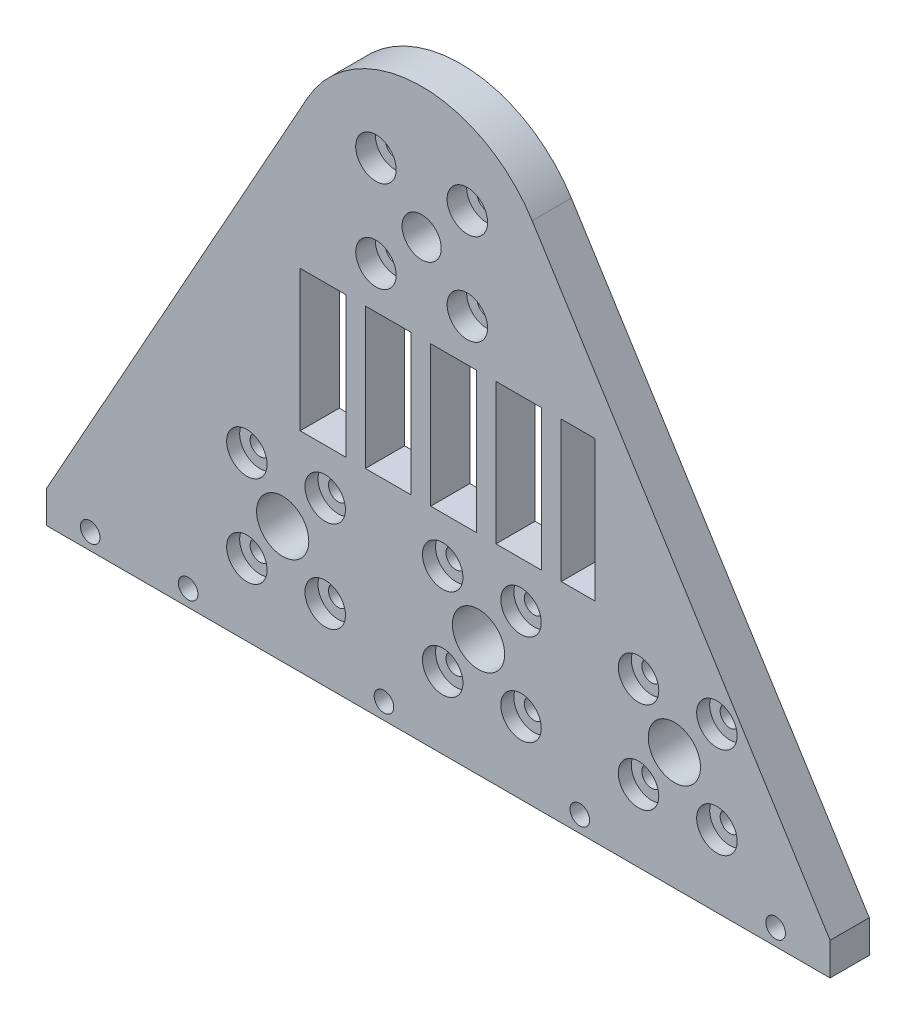
from build123d import *

# Parameters (mm, degrees)
SKETCH_1_R           = 3
EXTRUDE_1_DEPTH      = 6
SKETCH_2_R           = 3.1
CUT_EXTRUDE_6_DEPTH  = 3
SKETCH_4_R           = 1.5
CUT_EXTRUDE_7_DEPTH  = 118.004713387
CUT_EXTRUDE_8_REACH  = 119.12
SKETCH_5_W           = 7
SKETCH_5_H           = 21.556656584
SKETCH_5_W_2         = 5.195776916
SKETCH_5_R           = 4
SKETCH_6_R           = 3.1
CUT_EXTRUDE_9_DEPTH  = 2
SKETCH_7_R           = 1.5
CUT_EXTRUDE_10_DEPTH = 118.034622889
SKETCH_8_R           = 1.5
CUT_EXTRUDE_11_DEPTH = 118.120036521


with BuildPart() as part:
    # 草图1 → 凸台-拉伸1 (new body)
    with BuildSketch(Plane.XY):
        with BuildLine():
            Line((53.211823486, 15.105307707), (98.846336292, -57.534028788))
            Line((98.846336292, -57.534028788), (98.846336292, -62.534028788))
            Line((98.846336292, -62.534028788), (-21.153663708, -62.534028788))
            Line((-21.153663708, -62.534028788), (-21.153663708, -57.534028788))
            Line((-21.153663708, -57.534028788), (18.804405563, 14.198660069))
            ThreePointArc((18.804405563, 14.198660069), (35.749695352, 24.459031414), (53.211823486, 15.105307707))
        make_face()
        with Locations((36.276519563, 4.465971212)):
            Circle(SKETCH_1_R, mode=Mode.SUBTRACT)
    extrude(amount=EXTRUDE_1_DEPTH)

    # 草图2 → 切除-拉伸6 (cut)
    with BuildSketch(Plane.XY.offset(6)):
        with Locations((29.276519563, 11.465971212)):
            Circle(SKETCH_2_R)
        with Locations((43.276519563, 11.465971212)):
            Circle(SKETCH_2_R)
        with Locations((43.276519563, -2.534028788)):
            Circle(SKETCH_2_R)
        with Locations((29.276519563, -2.534028788)):
            Circle(SKETCH_2_R)
    extrude(amount=-CUT_EXTRUDE_6_DEPTH, mode=Mode.SUBTRACT)

    # 草图4 → 切除-拉伸7 (cut, through all)
    with BuildSketch(Plane.XY.offset(3)):
        with Locations((43.276519563, 11.465971212)):
            Circle(SKETCH_4_R)
        with Locations((43.276519563, -2.534028788)):
            Circle(SKETCH_4_R)
        with Locations((29.276519563, -2.534028788)):
            Circle(SKETCH_4_R)
        with Locations((29.276519563, 11.465971212)):
            Circle(SKETCH_4_R)
    extrude(amount=-CUT_EXTRUDE_7_DEPTH, mode=Mode.SUBTRACT)

    # 草图5 → 切除-拉伸8 (cut, up to next)
    with BuildSketch(Plane.XY.offset(6), mode=Mode.PRIVATE) as cut_extrude_8_sk1:
        with Locations((21.160819148, -19.755700496)):
            Rectangle(SKETCH_5_W, SKETCH_5_H)
    cut_extrude_8_tool1 = extrude(cut_extrude_8_sk1.sketch, amount=-CUT_EXTRUDE_8_REACH, mode=Mode.PRIVATE) & part.part
    # 草图5 → 切除-拉伸8 (cut, up to next)
    with BuildSketch(Plane.XY.offset(6), mode=Mode.PRIVATE) as cut_extrude_8_sk2:
        with Locations((31.160819148, -19.755700496)):
            Rectangle(SKETCH_5_W, SKETCH_5_H)
    cut_extrude_8_tool2 = extrude(cut_extrude_8_sk2.sketch, amount=-CUT_EXTRUDE_8_REACH, mode=Mode.PRIVATE) & part.part
    # 草图5 → 切除-拉伸8 (cut, up to next)
    with BuildSketch(Plane.XY.offset(6), mode=Mode.PRIVATE) as cut_extrude_8_sk3:
        with Locations((41.160819148, -19.755700496)):
            Rectangle(SKETCH_5_W, SKETCH_5_H)
    cut_extrude_8_tool3 = extrude(cut_extrude_8_sk3.sketch, amount=-CUT_EXTRUDE_8_REACH, mode=Mode.PRIVATE) & part.part
    # 草图5 → 切除-拉伸8 (cut, up to next)
    with BuildSketch(Plane.XY.offset(6), mode=Mode.PRIVATE) as cut_extrude_8_sk4:
        with Locations((51.160819148, -19.755700496)):
            Rectangle(SKETCH_5_W, SKETCH_5_H)
    cut_extrude_8_tool4 = extrude(cut_extrude_8_sk4.sketch, amount=-CUT_EXTRUDE_8_REACH, mode=Mode.PRIVATE) & part.part
    # 草图5 → 切除-拉伸8 (cut, up to next)
    with BuildSketch(Plane.XY.offset(6), mode=Mode.PRIVATE) as cut_extrude_8_sk5:
        with Locations((60.258707606, -19.755700496)):
            Rectangle(SKETCH_5_W_2, SKETCH_5_H)
    cut_extrude_8_tool5 = extrude(cut_extrude_8_sk5.sketch, amount=-CUT_EXTRUDE_8_REACH, mode=Mode.PRIVATE) & part.part
    # 草图5 → 切除-拉伸8 (cut, up to next)
    with BuildSketch(Plane.XY.offset(6), mode=Mode.PRIVATE) as cut_extrude_8_sk6:
        with Locations((14.988200827, -44.534028788)):
            Circle(SKETCH_5_R)
    cut_extrude_8_tool6 = extrude(cut_extrude_8_sk6.sketch, amount=-CUT_EXTRUDE_8_REACH, mode=Mode.PRIVATE) & part.part
    # 草图5 → 切除-拉伸8 (cut, up to next)
    with BuildSketch(Plane.XY.offset(6), mode=Mode.PRIVATE) as cut_extrude_8_sk7:
        with Locations((44.988200827, -44.534028788)):
            Circle(SKETCH_5_R)
    cut_extrude_8_tool7 = extrude(cut_extrude_8_sk7.sketch, amount=-CUT_EXTRUDE_8_REACH, mode=Mode.PRIVATE) & part.part
    # 草图5 → 切除-拉伸8 (cut, up to next)
    with BuildSketch(Plane.XY.offset(6), mode=Mode.PRIVATE) as cut_extrude_8_sk8:
        with Locations((74.988200827, -44.534028788)):
            Circle(SKETCH_5_R)
    cut_extrude_8_tool8 = extrude(cut_extrude_8_sk8.sketch, amount=-CUT_EXTRUDE_8_REACH, mode=Mode.PRIVATE) & part.part
    add(cut_extrude_8_tool1.solids().sort_by_distance((21.160819, -19.7557, 6))[0], mode=Mode.SUBTRACT)
    add(cut_extrude_8_tool2.solids().sort_by_distance((31.160819, -19.7557, 6))[0], mode=Mode.SUBTRACT)
    add(cut_extrude_8_tool3.solids().sort_by_distance((41.160819, -19.7557, 6))[0], mode=Mode.SUBTRACT)
    add(cut_extrude_8_tool4.solids().sort_by_distance((51.160819, -19.7557, 6))[0], mode=Mode.SUBTRACT)
    add(cut_extrude_8_tool5.solids().sort_by_distance((60.258708, -19.7557, 6))[0], mode=Mode.SUBTRACT)
    add(cut_extrude_8_tool6.solids().sort_by_distance((14.988201, -44.534029, 6))[0], mode=Mode.SUBTRACT)
    add(cut_extrude_8_tool7.solids().sort_by_distance((44.988201, -44.534029, 6))[0], mode=Mode.SUBTRACT)
    add(cut_extrude_8_tool8.solids().sort_by_distance((74.988201, -44.534029, 6))[0], mode=Mode.SUBTRACT)

    # 草图6 → 切除-拉伸9 (cut)
    with BuildSketch(Plane.XY.offset(6)):
        with Locations((21.502321056, -37.534028788)):
            Circle(SKETCH_6_R)
        with Locations((9.502321056, -37.534028788)):
            Circle(SKETCH_6_R)
        with Locations((9.502321056, -51.534028788)):
            Circle(SKETCH_6_R)
        with Locations((21.502321056, -51.534028788)):
            Circle(SKETCH_6_R)
        with Locations((39.502321056, -37.534028788)):
            Circle(SKETCH_6_R)
        with Locations((51.502321056, -37.534028788)):
            Circle(SKETCH_6_R)
        with Locations((51.502321056, -51.534028788)):
            Circle(SKETCH_6_R)
        with Locations((39.502321056, -51.534028788)):
            Circle(SKETCH_6_R)
        with Locations((69.502321056, -37.534028788)):
            Circle(SKETCH_6_R)
        with Locations((81.502321056, -37.534028788)):
            Circle(SKETCH_6_R)
        with Locations((81.502321056, -51.534028788)):
            Circle(SKETCH_6_R)
        with Locations((69.502321056, -51.534028788)):
            Circle(SKETCH_6_R)
    extrude(amount=-CUT_EXTRUDE_9_DEPTH, mode=Mode.SUBTRACT)

    # 草图7 → 切除-拉伸10 (cut, through all)
    with BuildSketch(Plane.XY.offset(4)):
        with Locations((9.502321056, -37.534028788)):
            Circle(SKETCH_7_R)
        with Locations((21.502321056, -37.534028788)):
            Circle(SKETCH_7_R)
        with Locations((9.502321056, -51.534028788)):
            Circle(SKETCH_7_R)
        with Locations((21.502321056, -51.534028788)):
            Circle(SKETCH_7_R)
        with Locations((51.502321056, -51.534028788)):
            Circle(SKETCH_7_R)
        with Locations((39.502321056, -51.534028788)):
            Circle(SKETCH_7_R)
        with Locations((39.502321056, -37.534028788)):
            Circle(SKETCH_7_R)
        with Locations((51.502321056, -37.534028788)):
            Circle(SKETCH_7_R)
        with Locations((81.502321056, -51.534028788)):
            Circle(SKETCH_7_R)
        with Locations((69.502321056, -51.534028788)):
            Circle(SKETCH_7_R)
        with Locations((69.502321056, -37.534028788)):
            Circle(SKETCH_7_R)
        with Locations((81.502321056, -37.534028788)):
            Circle(SKETCH_7_R)
    extrude(amount=-CUT_EXTRUDE_10_DEPTH, mode=Mode.SUBTRACT)

    # 草图8 → 切除-拉伸11 (cut, through all)
    with BuildSketch(Plane.XY.offset(6)):
        with Locations((90.502321056, -60.034028788)):
            Circle(SKETCH_8_R)
        with Locations((60.502321056, -60.034028788)):
            Circle(SKETCH_8_R)
        with Locations((30.502321056, -60.034028788)):
            Circle(SKETCH_8_R)
        with Locations((0.502321056, -60.034028788)):
            Circle(SKETCH_8_R)
        with Locations((-14.497678944, -60.034028788)):
            Circle(SKETCH_8_R)
    extrude(amount=-CUT_EXTRUDE_11_DEPTH, mode=Mode.SUBTRACT)


solid = part.part
